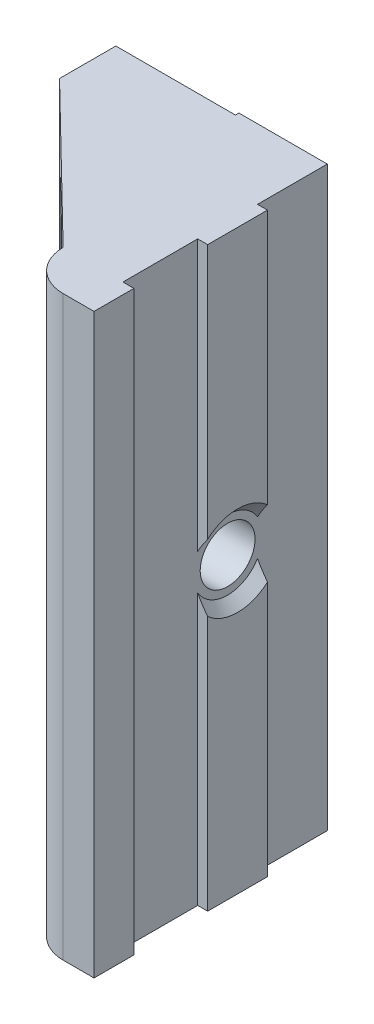
from build123d import *

# Parameters (mm, degrees)
SKETCH1_W           = 20.861
SKETCH1_H           = 57.912
SKETCH1_R           = 3.25
BOSS_EXTRUDE1_DEPTH = 6
BOSS_EXTRUDE2_DEPTH = 57.912
SKETCH8_R           = 3.25
CUT_EXTRUDE4_DEPTH  = 49.898888096
CUT_EXTRUDE5_START  = -6
SKETCH9_R           = 5.25
CUT_EXTRUDE5_DEPTH  = 43.898888096
SKETCH10_R          = 2.75
CUT_EXTRUDE6_DEPTH  = 44.28835013
CUT_EXTRUDE7_START  = -9
SKETCH11_R          = 5.25
CUT_EXTRUDE7_DEPTH  = 35.28835013
SKETCH12_W          = 12
SKETCH12_H          = 0.35
CUT_EXTRUDE8_DEPTH  = 71.046063879
FILLET1_R           = 4
BOSS_EXTRUDE3_START = 1
SKETCH13_W          = 6
SKETCH13_H          = 57.912
SKETCH13_R          = 2.75
BOSS_EXTRUDE3_DEPTH = 1
CHAMFER1_SIZE       = 2.5
SKETCH14_R          = 3.5
CUT_EXTRUDE9_DEPTH  = 1
CHAMFER2_SIZE       = 1


# Some blends are built 0.0001 mm under size
with BuildPart() as part:
    # Sketch1 → Boss-Extrude1 (new body)
    # profile 1 of 3: a face of its own
    with BuildSketch(Plane.XY):
        with Locations((-20.4305, 0)):
            Rectangle(SKETCH1_W, SKETCH1_H)
        with Locations((-24.8158, 19.05)):
            Circle(SKETCH1_R, mode=Mode.SUBTRACT)
        with Locations((-24.8158, -19.05)):
            Circle(SKETCH1_R, mode=Mode.SUBTRACT)
    # profile 2 of 3: a face of its own
    with BuildSketch(Plane.XY):
        with Locations((-24.8158, 19.05)):
            Circle(SKETCH1_R)
    # profile 3 of 3: a face of its own
    with BuildSketch(Plane.XY):
        with Locations((-24.8158, -19.05)):
            Circle(SKETCH1_R)
    extrude(amount=BOSS_EXTRUDE1_DEPTH)

    # Sketch7 → Boss-Extrude2 (add)
    with BuildSketch(Plane.XZ.offset(28.956)):
        Polygon((-30.861, 6), (-16, 20.5), (-16, 24.5), (-8.9, 24.5), (-8.9, 20.5), (-10, 20.5), (-10, 6), align=None)
    extrude(amount=-BOSS_EXTRUDE2_DEPTH)

    # Sketch8 → Cut-Extrude4 (cut, through all)
    with BuildSketch(Plane(origin=(0, 0, 0), x_dir=(-1, 0, 0), z_dir=(0, 0, -1))):
        with Locations((24.8158, -19.05)):
            Circle(SKETCH8_R)
        with Locations((24.8158, 19.05)):
            Circle(SKETCH8_R)
    extrude(amount=-CUT_EXTRUDE4_DEPTH, mode=Mode.SUBTRACT)

    # Sketch9 → Cut-Extrude5 (cut, through all)
    with BuildSketch(Plane(origin=(0, 0, 0), x_dir=(-1, 0, 0), z_dir=(0, 0, -1)).offset(CUT_EXTRUDE5_START)):
        with Locations((24.8158, -19.05)):
            Circle(SKETCH9_R)
        with Locations((24.8158, 19.05)):
            Circle(SKETCH9_R)
    extrude(amount=-CUT_EXTRUDE5_DEPTH, mode=Mode.SUBTRACT)

    # Sketch10 → Cut-Extrude6 (cut, through all)
    with BuildSketch(Plane(origin=(-10, 0, 0), x_dir=(0, 0, -1), z_dir=(1, 0, 0))):
        with Locations((-10, 0)):
            Circle(SKETCH10_R)
    extrude(amount=-CUT_EXTRUDE6_DEPTH, mode=Mode.SUBTRACT)

    # Sketch11 → Cut-Extrude7 (cut, through all)
    with BuildSketch(Plane(origin=(-10, 0, 0), x_dir=(0, 0, -1), z_dir=(1, 0, 0)).offset(CUT_EXTRUDE7_START)):
        with Locations((-10, 0)):
            Circle(SKETCH11_R)
    extrude(amount=-CUT_EXTRUDE7_DEPTH, mode=Mode.SUBTRACT)

    # Sketch12 → Cut-Extrude8 (cut, through all)
    with BuildSketch(Plane(origin=(0, 28.956, 0), x_dir=(1, 0, 0), z_dir=(0, 1, 0))):
        with Locations((-24.861, -0.175)):
            Rectangle(SKETCH12_W, SKETCH12_H)
    extrude(amount=-CUT_EXTRUDE8_DEPTH, mode=Mode.SUBTRACT)

    # Fillet1
    fillet1_edges = [part.edges().sort_by_distance(p)[0] for p in [
        (-16, 0, 24.5),
    ]]
    fillet(fillet1_edges, radius=FILLET1_R - 0.0001)  # a hair under: the kernel refuses the full size

    # Sketch13 → Boss-Extrude3 (add)
    with BuildSketch(Plane(origin=(-10, 0, 0), x_dir=(0, 0, -1), z_dir=(1, 0, 0)).offset(BOSS_EXTRUDE3_START)):
        with Locations((-10, 0)):
            Rectangle(SKETCH13_W, SKETCH13_H)
        with Locations((-10, 0)):
            Circle(SKETCH13_R, mode=Mode.SUBTRACT)
    extrude(amount=-BOSS_EXTRUDE3_DEPTH)

    # Chamfer1
    # the kernel refuses this chamfer: 2.5 mm, written as the material it adds along each edge
    with BuildSketch(Plane(origin=(-19, 0, 10), x_dir=(0, 0, -1), z_dir=(0, -1, 0))) as chamfer1_piece_1_section:
        Polygon((5.25 - CHAMFER1_SIZE, 0), (5.25, -CHAMFER1_SIZE), (5.25, 0), align=None)
    chamfer1_piece_1 = revolve(axis=Axis((-19, 0, 10), (1, 0, 0)), mode=Mode.PRIVATE)
    chamfer1_piece_1 = chamfer1_piece_1 - Plane(origin=(-20.253037954, 0, 10), x_dir=(0, 0, -1), z_dir=(1, 0, 0)) * Cylinder(2.75, 21, mode=Mode.PRIVATE)
    chamfer1_piece_1 = split(chamfer1_piece_1, bisect_by=Plane(origin=(-21.393994511, 0, 15.237035166), z_dir=(0.6983599622441906, 0, -0.7157467171662703)), keep=Keep.TOP, mode=Mode.PRIVATE)
    add(chamfer1_piece_1)

    # Sketch14 → Cut-Extrude9 (cut)
    with BuildSketch(Plane(origin=(-9, 0, 0), x_dir=(0, 0, -1), z_dir=(1, 0, 0))):
        with Locations((-10, 0)):
            Circle(SKETCH14_R)
    extrude(amount=-CUT_EXTRUDE9_DEPTH, mode=Mode.SUBTRACT)

    # Chamfer2
    chamfer2_edges = [part.edges().sort_by_distance(p)[0] for p in [
        (-9, -3.5, 10),
        (-9, 3.5, 10),
    ]]
    chamfer(chamfer2_edges, length=CHAMFER2_SIZE - 0.0001)  # a hair under: the kernel refuses the full size


solid = part.part
